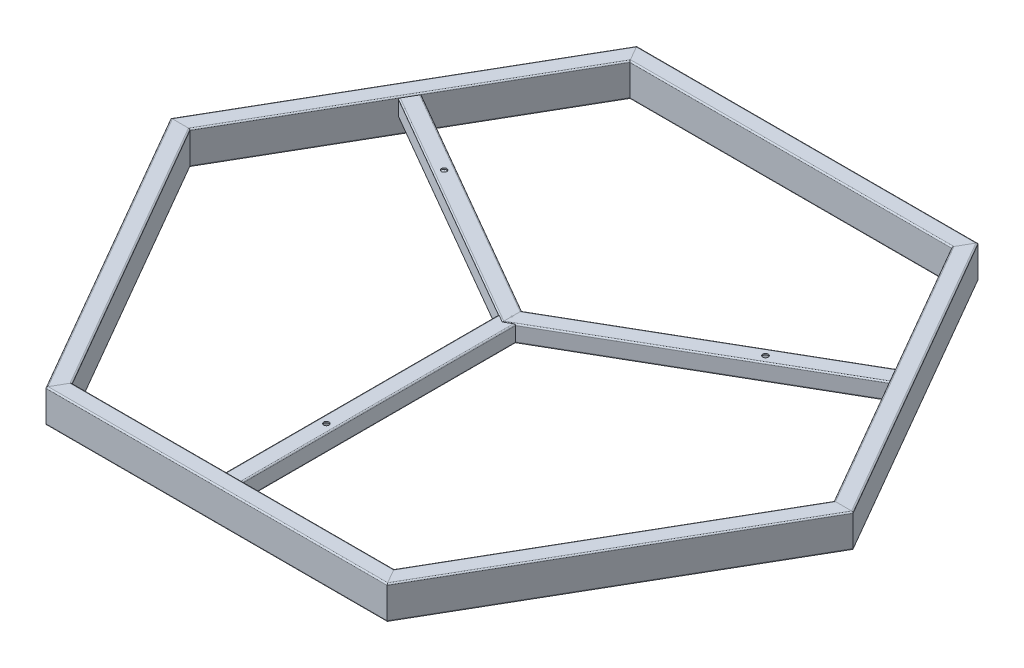
from build123d import *

# Parameters (mm, degrees)
RECTANGULAR_TUBE_25X50X2_1_DEPTH      = 546.900201903
RECTANGULAR_TUBE_25X50X2_1_DEPTH_BACK = 32.250890394
RECTANGULAR_TUBE_25X50X2_1_2_DEPTH    = 579.15252919
RECTANGULAR_TUBE_25X50X2_1_3_DEPTH    = 579.151092297
RECTANGULAR_TUBE_25X50X2_1_4_DEPTH    = 579.151810744
RECTANGULAR_TUBE_25X50X2_1_5_DEPTH    = 579.151810744
RECTANGULAR_TUBE_25X50X2_1_6_DEPTH    = 579.151810744
SQUARE_START                          = 7.33219287
SQUARE_TUBE_25_4X25_4X2_2_DEPTH       = 412.967651582
SQUARE_START_2                        = -26
SQUARE_TUBE_25_4X25_4X2_2_2_DEPTH     = 27
SQUARE_START_3                        = -7.332348419
SQUARE_TUBE_25_4X25_4X2_2_3_DEPTH     = 427.775958324
SQUARE_START_4                        = -14
SQUARE_TUBE_25_4X25_4X2_2_4_OUTLINE_W = 28
SQUARE_TUBE_25_4X25_4X2_2_4_OUTLINE_H = 32
SQUARE_TUBE_25_4X25_4X2_2_4_DEPTH     = 13.999910194
SQUARE_START_5                        = -421.563475231
SQUARE_TUBE_25_4X25_4X2_2_5_DEPTH     = 428.895668101
SQUARE_START_6                        = -8.9806e-05
SQUARE_TUBE_25_4X25_4X2_2_6_OUTLINE_W = 28
SQUARE_TUBE_25_4X25_4X2_2_6_OUTLINE_H = 32
SQUARE_TUBE_25_4X25_4X2_2_6_DEPTH     = 14.000089806
SKETCH2_R                             = 1
BOSS_EXTRUDE5_DEPTH                   = 26
SKETCH13_R                            = 4.1
CUT_EXTRUDE1_DEPTH                    = 683.507980458


with BuildPart() as part:
    # Sketch1 → Rectangular tube 25X50X2(1) (new, two sides: drawn at the far end of the back side and taken through both)
    with BuildSketch(Plane(origin=(-257.325014978, -23, 433.2), x_dir=(0, 0, -1), z_dir=(1, 0, 0)).offset(-RECTANGULAR_TUBE_25X50X2_1_DEPTH_BACK)):
        with BuildLine():
            Line((-10.5, 25), (10.5, 25))
            ThreePointArc((10.5, 25), (11.914213562, 24.414213562), (12.5, 23))
            Line((12.5, 23), (12.5, -23))
            ThreePointArc((12.5, -23), (11.914213562, -24.414213562), (10.5, -25))
            Line((10.5, -25), (-10.5, -25))
            ThreePointArc((-10.5, -25), (-11.914213562, -24.414213562), (-12.5, -23))
            Line((-12.5, -23), (-12.5, 23))
            ThreePointArc((-12.5, 23), (-11.914213562, 24.414213562), (-10.5, 25))
        make_face()
        with BuildLine():
            Line((-8.5, 23), (8.5, 23))
            ThreePointArc((8.5, 23), (9.914213562, 22.414213562), (10.5, 21))
            Line((10.5, 21), (10.5, -21))
            ThreePointArc((10.5, -21), (9.914213562, -22.414213562), (8.5, -23))
            Line((8.5, -23), (-8.5, -23))
            ThreePointArc((-8.5, -23), (-9.914213562, -22.414213562), (-10.5, -21))
            Line((-10.5, -21), (-10.5, 21))
            ThreePointArc((-10.5, 21), (-9.914213562, 22.414213562), (-8.5, 23))
        make_face(mode=Mode.SUBTRACT)
    extrude(amount=RECTANGULAR_TUBE_25X50X2_1_DEPTH + RECTANGULAR_TUBE_25X50X2_1_DEPTH_BACK)

    # Rectangular tube 25X50X2(1) mitre 1
    split(bisect_by=Plane(origin=(-257.325014978, 0, 445.7), x_dir=(0, 1, 0), z_dir=(0.866025404, 0, 0.5)), keep=Keep.TOP)

    # Rectangular tube 25X50X2(1) mitre 2
    split(bisect_by=Plane(origin=(257.324296531, 0, 445.7), x_dir=(0, -1, 0), z_dir=(-0.866025404, 0, 0.5)), keep=Keep.TOP)


with BuildPart() as body_2:
    # Sketch1 on segment 2 (carried to segment 2) → Rectangular tube 25X50X2_1 2 (new body)
    with BuildSketch(Plane(origin=(230.373533787, -23, 467.380090376), x_dir=(-0.866025404, 0, -0.5), z_dir=(0.5, 0, -0.866025404))):
        with BuildLine():
            Line((-10.5, 25), (10.5, 25))
            ThreePointArc((10.5, 25), (11.914213562, 24.414213562), (12.5, 23))
            Line((12.5, 23), (12.5, -23))
            ThreePointArc((12.5, -23), (11.914213562, -24.414213562), (10.5, -25))
            Line((10.5, -25), (-10.5, -25))
            ThreePointArc((-10.5, -25), (-11.914213562, -24.414213562), (-12.5, -23))
            Line((-12.5, -23), (-12.5, 23))
            ThreePointArc((-12.5, 23), (-11.914213562, 24.414213562), (-10.5, 25))
        make_face()
        with BuildLine():
            Line((-8.5, 23), (8.5, 23))
            ThreePointArc((8.5, 23), (9.914213562, 22.414213562), (10.5, 21))
            Line((10.5, 21), (10.5, -21))
            ThreePointArc((10.5, -21), (9.914213562, -22.414213562), (8.5, -23))
            Line((8.5, -23), (-8.5, -23))
            ThreePointArc((-8.5, -23), (-9.914213562, -22.414213562), (-10.5, -21))
            Line((-10.5, -21), (-10.5, 21))
            ThreePointArc((-10.5, 21), (-9.914213562, 22.414213562), (-8.5, 23))
        make_face(mode=Mode.SUBTRACT)
    extrude(amount=RECTANGULAR_TUBE_25X50X2_1_2_DEPTH)

    # Rectangular tube 25X50X2_1 2 mitre 1
    split(bisect_by=Plane(origin=(257.324296531, 0, 445.7), x_dir=(0, 1, 0), z_dir=(0.866025404, 0, -0.5)), keep=Keep.TOP)

    # Rectangular tube 25X50X2_1 2 mitre 2
    split(bisect_by=Plane(origin=(514.649670732, 0, -0.000622193), x_dir=(0, -1, 0), z_dir=(0, 0, 1)), keep=Keep.TOP)


with BuildPart() as body_3:
    # Sketch1 on segment 3 (carried to segment 3) → Rectangular tube 25X50X2_1 3 (new body)
    with BuildSketch(Plane(origin=(519.949798382, -23, 34.179468183), x_dir=(-0.866025404, 0, 0.5), z_dir=(-0.5, 0, -0.866025404))):
        with BuildLine():
            Line((-10.5, 25), (10.5, 25))
            ThreePointArc((10.5, 25), (11.914213562, 24.414213562), (12.5, 23))
            Line((12.5, 23), (12.5, -23))
            ThreePointArc((12.5, -23), (11.914213562, -24.414213562), (10.5, -25))
            Line((10.5, -25), (-10.5, -25))
            ThreePointArc((-10.5, -25), (-11.914213562, -24.414213562), (-12.5, -23))
            Line((-12.5, -23), (-12.5, 23))
            ThreePointArc((-12.5, 23), (-11.914213562, 24.414213562), (-10.5, 25))
        make_face()
        with BuildLine():
            Line((-8.5, 23), (8.5, 23))
            ThreePointArc((8.5, 23), (9.914213562, 22.414213562), (10.5, 21))
            Line((10.5, 21), (10.5, -21))
            ThreePointArc((10.5, -21), (9.914213562, -22.414213562), (8.5, -23))
            Line((8.5, -23), (-8.5, -23))
            ThreePointArc((-8.5, -23), (-9.914213562, -22.414213562), (-10.5, -21))
            Line((-10.5, -21), (-10.5, 21))
            ThreePointArc((-10.5, 21), (-9.914213562, 22.414213562), (-8.5, 23))
        make_face(mode=Mode.SUBTRACT)
    extrude(amount=RECTANGULAR_TUBE_25X50X2_1_3_DEPTH)

    # Rectangular tube 25X50X2_1 3 mitre 1
    split(bisect_by=Plane(origin=(514.649670732, 0, -0.000622193), x_dir=(0, 1, 0), z_dir=(0, 0, -1)), keep=Keep.TOP)

    # Rectangular tube 25X50X2_1 3 mitre 2
    split(bisect_by=Plane(origin=(257.325014978, 0, -445.7), x_dir=(0, 1, 0), z_dir=(0.866025404, 0, 0.5)), keep=Keep.TOP)


with BuildPart() as body_4:
    # Sketch1 on segment 4 (carried to segment 4) → Rectangular tube 25X50X2_1 4 (new body)
    with BuildSketch(Plane(origin=(289.575905372, -23, -433.2), x_dir=(0, 0, 1), z_dir=(-1, 0, 0))):
        with BuildLine():
            Line((-10.5, 25), (10.5, 25))
            ThreePointArc((10.5, 25), (11.914213562, 24.414213562), (12.5, 23))
            Line((12.5, 23), (12.5, -23))
            ThreePointArc((12.5, -23), (11.914213562, -24.414213562), (10.5, -25))
            Line((10.5, -25), (-10.5, -25))
            ThreePointArc((-10.5, -25), (-11.914213562, -24.414213562), (-12.5, -23))
            Line((-12.5, -23), (-12.5, 23))
            ThreePointArc((-12.5, 23), (-11.914213562, 24.414213562), (-10.5, 25))
        make_face()
        with BuildLine():
            Line((-8.5, 23), (8.5, 23))
            ThreePointArc((8.5, 23), (9.914213562, 22.414213562), (10.5, 21))
            Line((10.5, 21), (10.5, -21))
            ThreePointArc((10.5, -21), (9.914213562, -22.414213562), (8.5, -23))
            Line((8.5, -23), (-8.5, -23))
            ThreePointArc((-8.5, -23), (-9.914213562, -22.414213562), (-10.5, -21))
            Line((-10.5, -21), (-10.5, 21))
            ThreePointArc((-10.5, 21), (-9.914213562, 22.414213562), (-8.5, 23))
        make_face(mode=Mode.SUBTRACT)
    extrude(amount=RECTANGULAR_TUBE_25X50X2_1_4_DEPTH)

    # Rectangular tube 25X50X2_1 4 mitre 1
    split(bisect_by=Plane(origin=(257.325014978, 0, -445.7), x_dir=(0, -1, 0), z_dir=(-0.866025404, 0, -0.5)), keep=Keep.TOP)

    # Rectangular tube 25X50X2_1 4 mitre 2
    split(bisect_by=Plane(origin=(-257.325014978, 0, -445.7), x_dir=(0, 1, 0), z_dir=(0.866025404, 0, -0.5)), keep=Keep.TOP)


with BuildPart() as body_5:
    # Sketch1 on segment 5 (carried to segment 5) → Rectangular tube 25X50X2_1 5 (new body)
    with BuildSketch(Plane(origin=(-230.374252234, -23, -467.380090376), x_dir=(0.866025404, 0, 0.5), z_dir=(-0.5, 0, 0.866025404))):
        with BuildLine():
            Line((-10.5, 25), (10.5, 25))
            ThreePointArc((10.5, 25), (11.914213562, 24.414213562), (12.5, 23))
            Line((12.5, 23), (12.5, -23))
            ThreePointArc((12.5, -23), (11.914213562, -24.414213562), (10.5, -25))
            Line((10.5, -25), (-10.5, -25))
            ThreePointArc((-10.5, -25), (-11.914213562, -24.414213562), (-12.5, -23))
            Line((-12.5, -23), (-12.5, 23))
            ThreePointArc((-12.5, 23), (-11.914213562, 24.414213562), (-10.5, 25))
        make_face()
        with BuildLine():
            Line((-8.5, 23), (8.5, 23))
            ThreePointArc((8.5, 23), (9.914213562, 22.414213562), (10.5, 21))
            Line((10.5, 21), (10.5, -21))
            ThreePointArc((10.5, -21), (9.914213562, -22.414213562), (8.5, -23))
            Line((8.5, -23), (-8.5, -23))
            ThreePointArc((-8.5, -23), (-9.914213562, -22.414213562), (-10.5, -21))
            Line((-10.5, -21), (-10.5, 21))
            ThreePointArc((-10.5, 21), (-9.914213562, 22.414213562), (-8.5, 23))
        make_face(mode=Mode.SUBTRACT)
    extrude(amount=RECTANGULAR_TUBE_25X50X2_1_5_DEPTH)

    # Rectangular tube 25X50X2_1 5 mitre 1
    split(bisect_by=Plane(origin=(-257.325014978, 0, -445.7), x_dir=(0, -1, 0), z_dir=(-0.866025404, 0, 0.5)), keep=Keep.TOP)

    # Rectangular tube 25X50X2_1 5 mitre 2
    split(bisect_by=Plane(origin=(-514.650029956, 0, 0), x_dir=(0, 1, 0), z_dir=(0, 0, -1)), keep=Keep.TOP)


with BuildPart() as body_6:
    # Sketch1 on segment 6 (carried to segment 6) → Rectangular tube 25X50X2_1 6 (new body)
    with BuildSketch(Plane(origin=(-519.950157605, -23, -34.180090376), x_dir=(0.866025404, 0, -0.5), z_dir=(0.5, 0, 0.866025404))):
        with BuildLine():
            Line((-10.5, 25), (10.5, 25))
            ThreePointArc((10.5, 25), (11.914213562, 24.414213562), (12.5, 23))
            Line((12.5, 23), (12.5, -23))
            ThreePointArc((12.5, -23), (11.914213562, -24.414213562), (10.5, -25))
            Line((10.5, -25), (-10.5, -25))
            ThreePointArc((-10.5, -25), (-11.914213562, -24.414213562), (-12.5, -23))
            Line((-12.5, -23), (-12.5, 23))
            ThreePointArc((-12.5, 23), (-11.914213562, 24.414213562), (-10.5, 25))
        make_face()
        with BuildLine():
            Line((-8.5, 23), (8.5, 23))
            ThreePointArc((8.5, 23), (9.914213562, 22.414213562), (10.5, 21))
            Line((10.5, 21), (10.5, -21))
            ThreePointArc((10.5, -21), (9.914213562, -22.414213562), (8.5, -23))
            Line((8.5, -23), (-8.5, -23))
            ThreePointArc((-8.5, -23), (-9.914213562, -22.414213562), (-10.5, -21))
            Line((-10.5, -21), (-10.5, 21))
            ThreePointArc((-10.5, 21), (-9.914213562, 22.414213562), (-8.5, 23))
        make_face(mode=Mode.SUBTRACT)
    extrude(amount=RECTANGULAR_TUBE_25X50X2_1_6_DEPTH)

    # Rectangular tube 25X50X2_1 6 mitre 1
    split(bisect_by=Plane(origin=(-514.650029956, 0, 0), x_dir=(0, -1, 0), z_dir=(0, 0, 1)), keep=Keep.TOP)

    # Rectangular tube 25X50X2_1 6 mitre 2
    split(bisect_by=Plane(origin=(-257.325014978, 0, 445.7), x_dir=(0, -1, 0), z_dir=(-0.866025404, 0, -0.5)), keep=Keep.TOP)


with BuildPart() as body_7:
    # Square tube 25_4X25_4X2(2): read off the stored shape, not the designer's step
    # Square tube 25_4X25_4X2(2) outline → Square tube 25_4X25_4X2(2) (new body)
    with BuildSketch(Plane.XY.offset(SQUARE_START)):
        with BuildLine():
            ThreePointArc((10.699910194, -25.4), (12.114123756, -24.814213563), (12.699910194, -23.4))
            Line((12.699910194, -23.4), (12.699910194, -2))
            ThreePointArc((12.699910194, -2), (12.114123756, -0.585786437), (10.699910194, 0))
            Line((10.699910194, 0), (-10.700089806, 0))
            ThreePointArc((-10.700089806, 0), (-12.114303368, -0.585786438), (-12.700089806, -2))
            Line((-12.700089806, -2), (-12.700089806, -23.4))
            ThreePointArc((-12.700089806, -23.4), (-12.114303368, -24.814213562), (-10.700089806, -25.4))
            Line((-10.700089806, -25.4), (10.699910194, -25.4))
        make_face()
        with BuildLine():
            Line((10.699910194, -4), (10.699910194, -21.4))
            ThreePointArc((10.699910194, -21.4), (10.114123756, -22.814213563), (8.699910194, -23.4))
            Line((8.699910194, -23.4), (-8.700089806, -23.4))
            ThreePointArc((-8.700089806, -23.4), (-10.114303368, -22.814213562), (-10.700089806, -21.4))
            Line((-10.700089806, -21.4), (-10.700089806, -4))
            ThreePointArc((-10.700089806, -4), (-10.114303368, -2.585786438), (-8.700089806, -2))
            Line((-8.700089806, -2), (8.699910194, -2))
            ThreePointArc((8.699910194, -2), (10.114123756, -2.585786437), (10.699910194, -4))
        make_face(mode=Mode.SUBTRACT)
    extrude(amount=SQUARE_TUBE_25_4X25_4X2_2_DEPTH)

    # Square tube 25_4X25_4X2_2 2 outline → Square tube 25_4X25_4X2_2 2 (cut)
    with BuildSketch(Plane(origin=(0, 0, 0), x_dir=(1, 0, 0), z_dir=(0, 1, 0)).offset(SQUARE_START_2)):
        Polygon((-12.700089806, -7.33219287), (-8.9806e-05, -14.664541289), (12.699910194, -7.33219287), align=None)
    extrude(amount=SQUARE_TUBE_25_4X25_4X2_2_2_DEPTH, mode=Mode.SUBTRACT)


with BuildPart() as body_8:
    # Square tube 25_4X25_4X2_2 3 outline → Square tube 25_4X25_4X2_2 3 (new body)
    with BuildSketch(Plane(origin=(0, 0, 0), x_dir=(0.4999999999999966, 0, 0.8660254037844406), z_dir=(0.8660254037844406, 0, -0.4999999999999967)).offset(SQUARE_START_3)):
        with BuildLine():
            Line((12.699820388, 2), (12.699820388, 23.4))
            ThreePointArc((12.699820388, 23.4), (12.11403395, 24.814213563), (10.699820388, 25.4))
            Line((10.699820388, 25.4), (-10.700179612, 25.4))
            ThreePointArc((-10.700179612, 25.4), (-12.114393174, 24.814213562), (-12.700179612, 23.4))
            Line((-12.700179612, 23.4), (-12.700179612, 2))
            ThreePointArc((-12.700179612, 2), (-12.114393174, 0.585786438), (-10.700179612, 0))
            Line((-10.700179612, 0), (10.699820388, 0))
            ThreePointArc((10.699820388, 0), (12.11403395, 0.585786437), (12.699820388, 2))
        make_face()
        with BuildLine():
            ThreePointArc((8.699820388, 23.4), (10.11403395, 22.814213563), (10.699820388, 21.4))
            Line((10.699820388, 21.4), (10.699820388, 4))
            ThreePointArc((10.699820388, 4), (10.11403395, 2.585786437), (8.699820388, 2))
            Line((8.699820388, 2), (-8.700179612, 2))
            ThreePointArc((-8.700179612, 2), (-10.114393174, 2.585786438), (-10.700179612, 4))
            Line((-10.700179612, 4), (-10.700179612, 21.4))
            ThreePointArc((-10.700179612, 21.4), (-10.114393174, 22.814213562), (-8.700179612, 23.4))
            Line((-8.700179612, 23.4), (8.699820388, 23.4))
        make_face(mode=Mode.SUBTRACT)
    extrude(amount=SQUARE_TUBE_25_4X25_4X2_2_3_DEPTH)

    # Square tube 25_4X25_4X2_2 4 outline → Square tube 25_4X25_4X2_2 4 (cut)
    with BuildSketch(Plane.YZ.offset(SQUARE_START_4)):
        with Locations((-13, 0)):
            Rectangle(SQUARE_TUBE_25_4X25_4X2_2_4_OUTLINE_W, SQUARE_TUBE_25_4X25_4X2_2_4_OUTLINE_H)
    extrude(amount=SQUARE_TUBE_25_4X25_4X2_2_4_DEPTH, mode=Mode.SUBTRACT)


with BuildPart() as body_9:
    # Square tube 25_4X25_4X2_2 5 outline → Square tube 25_4X25_4X2_2 5 (new body)
    with BuildSketch(Plane(origin=(0, 0, 0), x_dir=(0.5000000000000027, 0, -0.8660254037844373), z_dir=(0.866025403784437, 0, 0.500000000000003)).offset(SQUARE_START_5)):
        with BuildLine():
            Line((-12.699910194, -2), (-12.699910194, -23.4))
            ThreePointArc((-12.699910194, -23.4), (-12.114123756, -24.814213563), (-10.699910194, -25.4))
            Line((-10.699910194, -25.4), (10.700089806, -25.4))
            ThreePointArc((10.700089806, -25.4), (12.114303368, -24.814213562), (12.700089806, -23.4))
            Line((12.700089806, -23.4), (12.700089806, -2))
            ThreePointArc((12.700089806, -2), (12.114303368, -0.585786438), (10.700089806, 0))
            Line((10.700089806, 0), (-10.699910194, 0))
            ThreePointArc((-10.699910194, 0), (-12.114123756, -0.585786437), (-12.699910194, -2))
        make_face()
        with BuildLine():
            ThreePointArc((-8.699910194, -23.4), (-10.114123756, -22.814213563), (-10.699910194, -21.4))
            Line((-10.699910194, -21.4), (-10.699910194, -4))
            ThreePointArc((-10.699910194, -4), (-10.114123756, -2.585786437), (-8.699910194, -2))
            Line((-8.699910194, -2), (8.700089806, -2))
            ThreePointArc((8.700089806, -2), (10.114303368, -2.585786438), (10.700089806, -4))
            Line((10.700089806, -4), (10.700089806, -21.4))
            ThreePointArc((10.700089806, -21.4), (10.114303368, -22.814213562), (8.700089806, -23.4))
            Line((8.700089806, -23.4), (-8.699910194, -23.4))
        make_face(mode=Mode.SUBTRACT)
    extrude(amount=SQUARE_TUBE_25_4X25_4X2_2_5_DEPTH)

    # Square tube 25_4X25_4X2_2 6 outline → Square tube 25_4X25_4X2_2 6 (cut)
    with BuildSketch(Plane.YZ.offset(SQUARE_START_6)):
        with Locations((-13, 0)):
            Rectangle(SQUARE_TUBE_25_4X25_4X2_2_6_OUTLINE_W, SQUARE_TUBE_25_4X25_4X2_2_6_OUTLINE_H)
    extrude(amount=SQUARE_TUBE_25_4X25_4X2_2_6_DEPTH, mode=Mode.SUBTRACT)


with BuildPart() as body_10:
    # Sketch2 → Boss-Extrude5 (new body)
    with BuildSketch(Plane(origin=(0, 0, 0), x_dir=(1, 0, 0), z_dir=(0, 1, 0))):
        with Locations(Location((-8.9806e-05, 0.000155548, 0), (0, 0, 270))):
            Circle(SKETCH2_R)
    extrude(amount=-BOSS_EXTRUDE5_DEPTH)


with BuildPart() as cut_extrude1_tool:
    # Sketch13 → Cut-Extrude1 (new, through all)
    with BuildSketch(Plane(origin=(0, 0, 0), x_dir=(1, 0, 0), z_dir=(0, 1, 0))):
        with Locations(Location((242.487112196, 140.000001496, 0), (0, 0, 270))):
            Circle(SKETCH13_R)
        with Locations(Location((0, -279.999997007, 0), (0, 0, 270))):
            Circle(SKETCH13_R)
        with Locations(Location((-242.487083235, 140.000051657, 0), (0, 0, 270))):
            Circle(SKETCH13_R)
    extrude(amount=-CUT_EXTRUDE1_DEPTH)


with BuildPart() as body_7_1:
    add(body_7.part)

    # Cut-Extrude1: cut by cut_extrude1_tool
    add(cut_extrude1_tool.part, mode=Mode.SUBTRACT)


with BuildPart() as body_8_1:
    add(body_8.part)

    # Cut-Extrude1: cut by cut_extrude1_tool
    add(cut_extrude1_tool.part, mode=Mode.SUBTRACT)


with BuildPart() as body_9_1:
    add(body_9.part)

    # Cut-Extrude1: cut by cut_extrude1_tool
    add(cut_extrude1_tool.part, mode=Mode.SUBTRACT)


solid = Compound([part.part, body_2.part, body_3.part, body_4.part, body_5.part, body_6.part, body_10.part, body_7_1.part, body_8_1.part, body_9_1.part])
